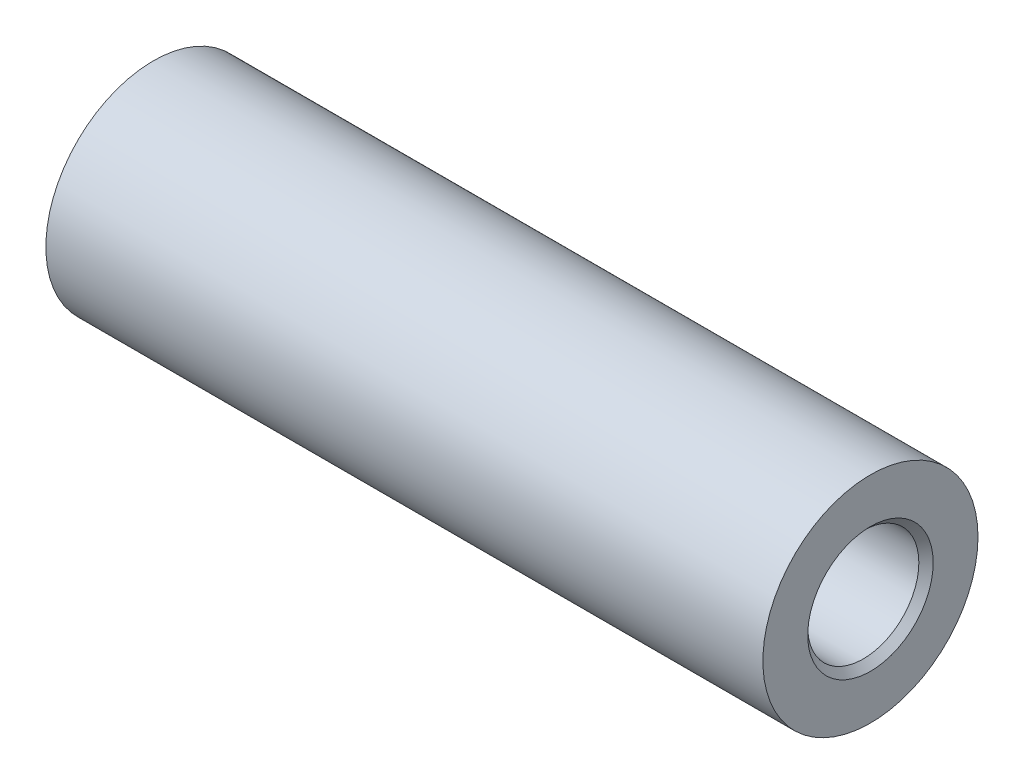
from build123d import *

# Parameters (mm, degrees)
EXTRUDE_1_DEPTH      = 19
EXTRUDE_1_DEPTH_BACK = 21
SKETCH_1_R           = 6
SKETCH_3_R           = 3.1
CUT_EXTRUDE_1_DEPTH  = 17
SKETCH_4_R           = 4.1
CUT_EXTRUDE_2_DEPTH  = 21
EXTRUDE_START        = 12
EXTRUDE_2_DEPTH      = 12
EXTRUDE_START_2      = 15
EXTRUDE_3_DEPTH      = 15
CHAMFER_1_SIZE       = 0.4
CHAMFER_2_SIZE       = 0.5


with BuildPart() as part:
    # 草图1 → 凸台-拉伸1 (new, two sides: drawn at the far end of the back side and taken through both)
    with BuildSketch(Plane(origin=(0, 0, 0), x_dir=(0, 0, -1), z_dir=(1, 0, 0)).offset(-EXTRUDE_1_DEPTH_BACK)):
        Circle(SKETCH_1_R)
    extrude(amount=EXTRUDE_1_DEPTH + EXTRUDE_1_DEPTH_BACK)

    # 草图3 → 切除-拉伸1 (cut)
    with BuildSketch(Plane(origin=(19, 0, 0), x_dir=(0, 0, -1), z_dir=(1, 0, 0))):
        Circle(SKETCH_3_R)
    extrude(amount=-CUT_EXTRUDE_1_DEPTH, mode=Mode.SUBTRACT)

    # 草图4 → 切除-拉伸2 (cut)
    with BuildSketch(Plane.ZY.offset(21)):
        Circle(SKETCH_4_R)
    extrude(amount=-CUT_EXTRUDE_2_DEPTH, mode=Mode.SUBTRACT)

    # 草图5 → 凸台-拉伸2 (add)
    with BuildSketch(Plane(origin=(2, 0, 0), x_dir=(0, 0, -1), z_dir=(1, 0, 0)).offset(EXTRUDE_START)):
        with BuildLine():
            Line((-1.688194302, 2.6), (1.688194302, 2.6))
            ThreePointArc((1.688194302, 2.6), (0, 3.1), (-1.688194302, 2.6))
        make_face()
    extrude(amount=-EXTRUDE_2_DEPTH)

    # 草图6 → 凸台-拉伸3 (add)
    with BuildSketch(Plane.ZY.offset(EXTRUDE_START_2)):
        with BuildLine():
            Line((-1.748205844, 3.708608408), (2.169358352, 3.479063716))
            ThreePointArc((2.169358352, 3.479063716), (0.239822956, 4.09297996), (-1.748205844, 3.708608408))
        make_face()
    extrude(amount=-EXTRUDE_3_DEPTH)

    # 倒角1
    chamfer_1_edges = [part.edges().sort_by_distance(p)[0] for p in [
        (-21, 0, -4.1),
        (19, 0, 3.1),
    ]]
    chamfer(chamfer_1_edges, length=CHAMFER_1_SIZE)

    # 倒角2
    chamfer_2_edges = [part.edges().sort_by_distance(p)[0] for p in [
        (-15, 3.593836062, 0.210576254),
        (14, 2.6, 0),
    ]]
    chamfer(chamfer_2_edges, length=CHAMFER_2_SIZE - 0.0001)  # a hair under: the kernel refuses the full size


solid = part.part
